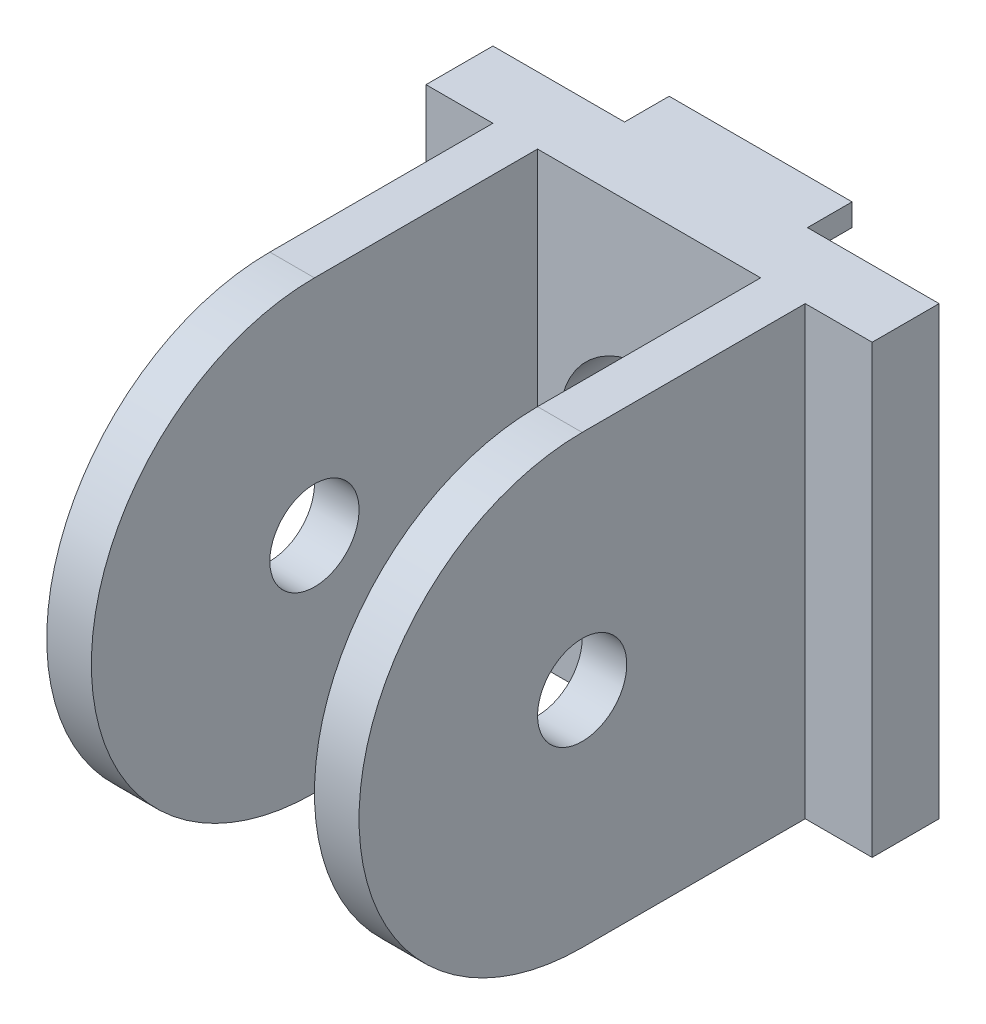
from build123d import *

# Parameters (mm, degrees)
SKETCH_1_W          = 20
SKETCH_1_H          = 20
EXTRUDE_1_DEPTH     = 3
SKETCH_2_W          = 2
SKETCH_2_H          = 20
EXTRUDE_2_DEPTH     = 20
CUT_EXTRUDE_START   = -14
CUT_EXTRUDE_2_DEPTH = 14
SKETCH_4_R          = 2
CUT_EXTRUDE_3_DEPTH = 31.298514815
SKETCH_6_R          = 4
CUT_EXTRUDE_5_DEPTH = 25.494897428
SKETCH_7_W          = 8.2
SKETCH_7_H          = 1
EXTRUDE_3_DEPTH     = 2


# Read off the part's stored shape, not the designer's step: 切除-拉伸2
with BuildPart() as part:
    # 草图1 → 凸台-拉伸1 (new body)
    with BuildSketch(Plane.XY):
        Rectangle(SKETCH_1_W, SKETCH_1_H)
    extrude(amount=EXTRUDE_1_DEPTH)

    # 草图2 → 凸台-拉伸2 (add)
    with BuildSketch(Plane.XY.offset(3)):
        with Locations((-6, 0)):
            Rectangle(SKETCH_2_W, SKETCH_2_H)
        with Locations((6, 0)):
            Rectangle(SKETCH_2_W, SKETCH_2_H)
    extrude(amount=EXTRUDE_2_DEPTH)

    # 切除-拉伸2 outline → 切除-拉伸2 (cut)
    with BuildSketch(Plane.ZY.offset(7).offset(CUT_EXTRUDE_START)):
        with BuildLine():
            Line((23, 10), (13, 10))
            ThreePointArc((13, 10), (20.071067812, 7.071067812), (23, 0))
            Line((23, 0), (23, 10))
        make_face()
        with BuildLine():
            Line((23, -10), (23, 0))
            ThreePointArc((23, 0), (20.071067812, -7.071067812), (13, -10))
            Line((13, -10), (23, -10))
        make_face()
    extrude(amount=CUT_EXTRUDE_2_DEPTH, mode=Mode.SUBTRACT)

    # 草图4 → 切除-拉伸3 (cut, through all)
    with BuildSketch(Plane.ZY.offset(7)):
        with Locations((13, 0)):
            Circle(SKETCH_4_R)
    extrude(amount=-CUT_EXTRUDE_3_DEPTH, mode=Mode.SUBTRACT)

    # 草图6 → 切除-拉伸5 (cut, through all)
    with BuildSketch(Plane.XY.offset(3)):
        Circle(SKETCH_6_R)
    extrude(amount=-CUT_EXTRUDE_5_DEPTH, mode=Mode.SUBTRACT)

    # 草图7 → 凸台-拉伸3 (add)
    with BuildSketch(Plane(origin=(0, 0, 0), x_dir=(-1, 0, 0), z_dir=(0, 0, -1))):
        with Locations((0, 9.5)):
            Rectangle(SKETCH_7_W, SKETCH_7_H)
        with Locations((0, -9.5)):
            Rectangle(SKETCH_7_W, SKETCH_7_H)
    extrude(amount=EXTRUDE_3_DEPTH)


solid = part.part
